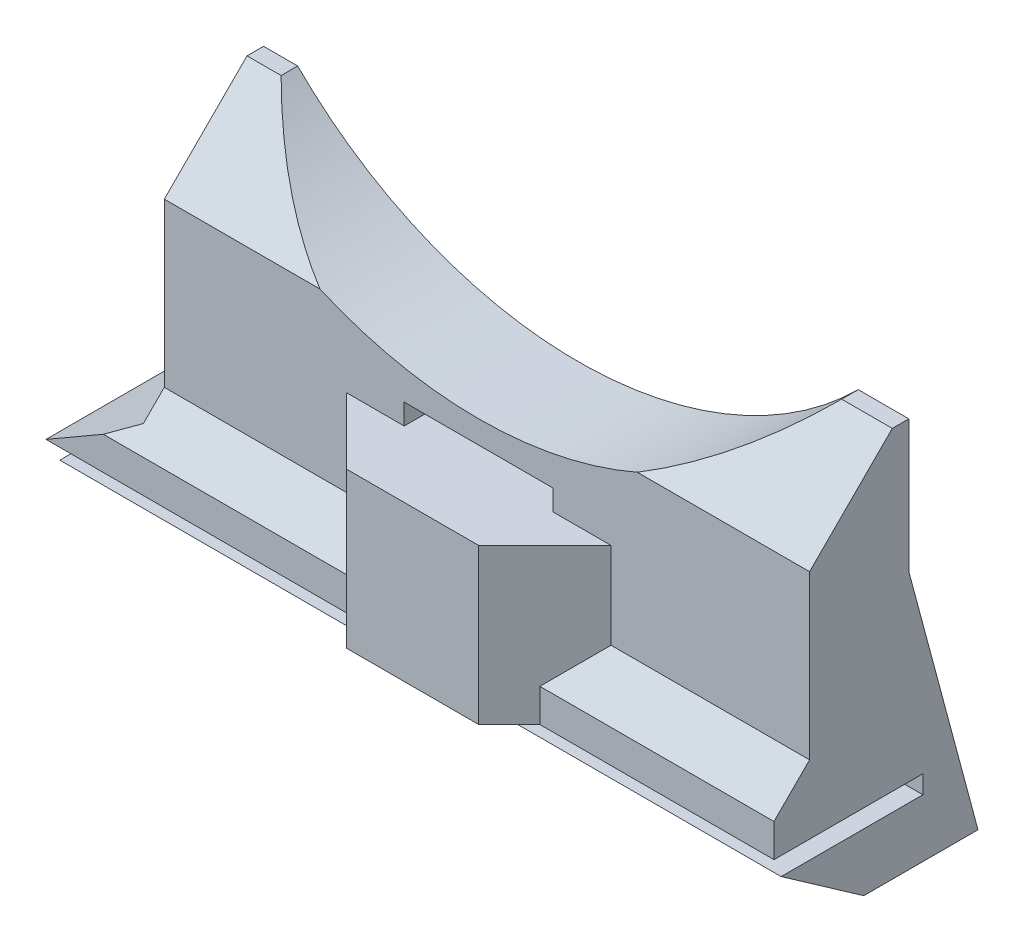
from build123d import *

# Parameters (mm, degrees)
BOSS_EXTRUDE1_DEPTH     = 20
BOSS_EXTRUDE4_DEPTH     = 6
CHAMFER4_SIZE           = 5
BOSS_EXTRUDE5_DEPTH     = 4
CUT_EXTRUDE4_DEPTH      = 33.573148451
CUT_EXTRUDE4_DEPTH_BACK = 33.573148451
FILLET1_R               = 10
CHAMFER5_SIZE           = 2.5
SKETCH17_W              = 9
SKETCH17_H              = 1.25
CUT_EXTRUDE5_DEPTH      = 33.573148451
SKETCH18_W              = 8
SKETCH18_H              = 9.375
BOSS_EXTRUDE6_DEPTH     = 4
BOSS_EXTRUDE8_REACH     = 33.067


with BuildPart() as part:
    # Sketch1 → Boss-Extrude1 (new, symmetric)
    with BuildSketch(Plane(origin=(0, 0, 0), x_dir=(0, 0, -1), z_dir=(1, 0, 0))):
        Polygon((0, -6), (4, -6), (-0.849880383, 12.1), (-6.849880383, 12.1), (-6.849880383, 5.250119617), (-9, 3.1), (-9, 1.1), (0, 1.1), (0, 0), (-8.56888804, 0), align=None)
    extrude(amount=BOSS_EXTRUDE1_DEPTH, both=True)

    # Sketch7 → Boss-Extrude4 (add)
    with BuildSketch(Plane.XY.offset(6.849880383)):
        with BuildLine():
            Line((-20, 12.1), (-20, 20.1))
            Line((-20, 20.1), (-16.941074346, 20.1))
            ThreePointArc((-16.941074346, 20.1), (0, 13.1), (16.941074346, 20.1))
            Line((16.941074346, 20.1), (20, 20.1))
            Line((20, 20.1), (20, 12.1))
            Line((20, 12.1), (-20, 12.1))
        make_face()
    extrude(amount=-BOSS_EXTRUDE4_DEPTH)

    # Chamfer4
    chamfer4_edges = [part.edges().sort_by_distance(p)[0] for p in [
        (-18.470537173, 20.1, 6.849880383),
        (18.470537173, 20.1, 6.849880383),
    ]]
    chamfer(chamfer4_edges, length=CHAMFER4_SIZE)

    # Sketch15 → Boss-Extrude5 (add)
    with BuildSketch(Plane.ZY.offset(20)):
        Polygon((9, 1.1), (9, 3.1), (6.849880383, 5.250119617), (6.849880383, 15.1), (1.849880383, 20.1), (0.849880383, 20.1), (0.849880383, 12.1), (-4, -6), (0, -6), (8.56888804, 0), (0, 0), (0, 1.1), align=None)
    extrude(amount=BOSS_EXTRUDE5_DEPTH)

    # Sketch16 → Cut-Extrude4 (cut, two sides: drawn at the far end of the back side and taken through both)
    with BuildSketch(Plane.XY.offset(-CUT_EXTRUDE4_DEPTH_BACK)):
        Polygon((-24, 1.1), (-19, 3.986751346), (-19, 20.1), (-24, 20.1), align=None)
    extrude(amount=CUT_EXTRUDE4_DEPTH + CUT_EXTRUDE4_DEPTH_BACK, mode=Mode.SUBTRACT)

    # Fillet1
    # the kernel refuses this fillet: 10 mm, written as the material it takes off along each edge
    with BuildSketch(Plane(origin=(-24, -6, -27.925666135), x_dir=(1, 0, 0), z_dir=(0, 0, 1))) as fillet1_piece_1:
        with BuildLine():
            CenterArc((9.570266454, 10), FILLET1_R, 196.857956022, 73.142043978)
            Line((0, 7.1), (-0.191405329, 7.042))
            ThreePointArc((-0.191405329, 7.042), (-0.2, 3.55), (-0.2, 0))
            Line((-0.2, 0), (0, -0.2))
            Line((0, -0.2), (9.570266454, -0.2))
            Line((9.570266454, -0.2), (9.570266454, 0))
        make_face()
    extrude(amount=51.85133227, mode=Mode.SUBTRACT)

    # Chamfer5
    chamfer5_edges = [part.edges().sort_by_distance(p)[0] for p in [
        (20, -6, -2),
    ]]
    chamfer(chamfer5_edges, length=CHAMFER5_SIZE)

    # Sketch17 → Cut-Extrude5 (cut, through all)
    with BuildSketch(Plane.XY):
        with Locations((0, 11.1)):
            Rectangle(SKETCH17_W, SKETCH17_H)
    extrude(amount=CUT_EXTRUDE5_DEPTH, mode=Mode.SUBTRACT)

    # Sketch18 → Boss-Extrude6 (add)
    with BuildSketch(Plane.XY.offset(6.849880383)):
        with Locations((0, 5.7875)):
            Rectangle(SKETCH18_W, SKETCH18_H)
    extrude(amount=BOSS_EXTRUDE6_DEPTH)

    # Boss-Extrude8: up to this face of the body (flat: up to its plane)
    boss_extrude8_end = Plane(part.part.faces().sort_by_distance((-1.927949963, 1.1, 4.69543357))[0])
    # Sketch19 → Boss-Extrude8 (add, up to the picked face)
    with BuildSketch(Plane(origin=(0, 10.475, 0), x_dir=(1, 0, 0), z_dir=(0, 1, 0)), mode=Mode.PRIVATE) as boss_extrude8_sk1:
        Polygon((4, -6.849880383), (4, -10.849880383), (8, -6.849880383), align=None)
    boss_extrude8_tool1 = split(extrude(boss_extrude8_sk1.sketch, amount=-BOSS_EXTRUDE8_REACH, mode=Mode.PRIVATE), bisect_by=boss_extrude8_end, keep=Keep.BOTH, mode=Mode.PRIVATE)
    # Sketch19 → Boss-Extrude8 (add, up to the picked face)
    with BuildSketch(Plane(origin=(0, 10.475, 0), x_dir=(1, 0, 0), z_dir=(0, 1, 0)), mode=Mode.PRIVATE) as boss_extrude8_sk2:
        Polygon((-4, -6.849880383), (-8, -6.849880383), (-4, -10.849880383), align=None)
    boss_extrude8_tool2 = split(extrude(boss_extrude8_sk2.sketch, amount=-BOSS_EXTRUDE8_REACH, mode=Mode.PRIVATE), bisect_by=boss_extrude8_end, keep=Keep.BOTH, mode=Mode.PRIVATE)
    add(boss_extrude8_tool1.solids().sort_by(Axis((5.333333, 10.475, 8.183214), (0, -1, 0)))[0])
    add(boss_extrude8_tool2.solids().sort_by(Axis((-5.333333, 10.475, 8.183214), (0, -1, 0)))[0])


solid = part.part
